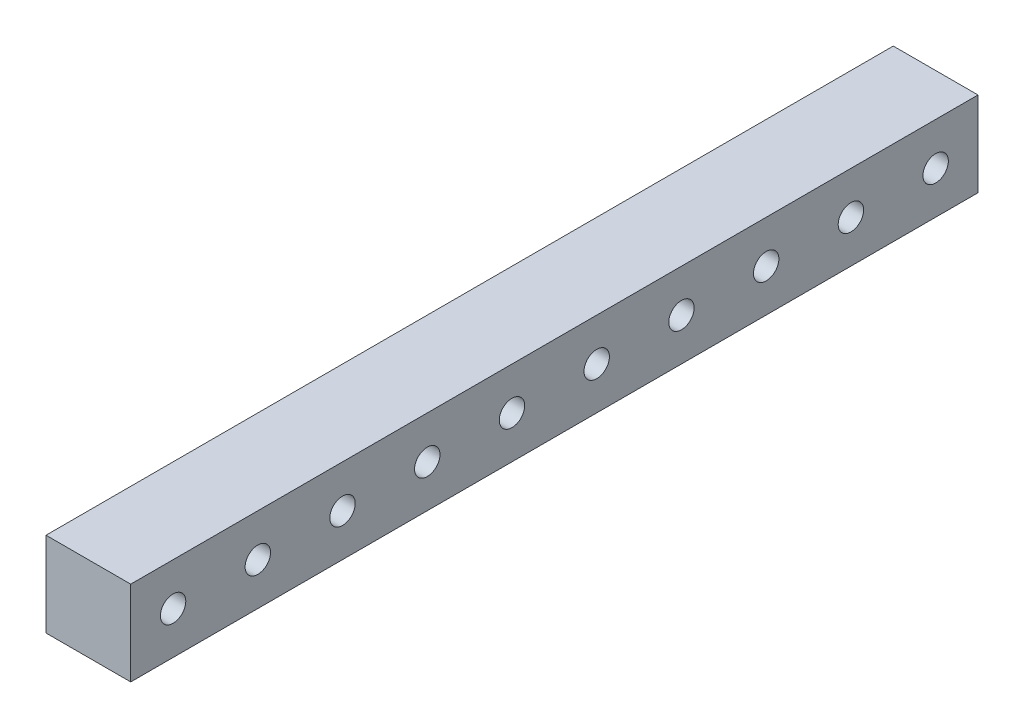
from build123d import *

# Parameters (mm, degrees)
SKETCH1_W             = 20
SKETCH1_H             = 20
BOSS_EXTRUDE1_DEPTH   = 200
F_6_0MM_DOWEL_HOLE1_D = 6
LPATTERN2_COUNT       = 10
LPATTERN2_PITCH       = 20


with BuildPart() as part:
    # Sketch1 → Boss-Extrude1 (new body)
    with BuildSketch(Plane.XY):
        Rectangle(SKETCH1_W, SKETCH1_H)
    extrude(amount=BOSS_EXTRUDE1_DEPTH)

    # Ø6.0mm Dowel Hole1 (through all)
    with Locations(Plane(origin=(10, 0, 0), x_dir=(0, 0, -1), z_dir=(1, 0, 0))):
        with Locations((-10, 0)):
            f_6_0mm_dowel_hole1 = Hole(F_6_0MM_DOWEL_HOLE1_D / 2)

    # LPattern2: Ø6.0mm Dowel Hole1 ×10
    with Locations(*[(0, 0, i * LPATTERN2_PITCH) for i in range(1, LPATTERN2_COUNT)]):
        add(f_6_0mm_dowel_hole1, mode=Mode.SUBTRACT)


solid = part.part
